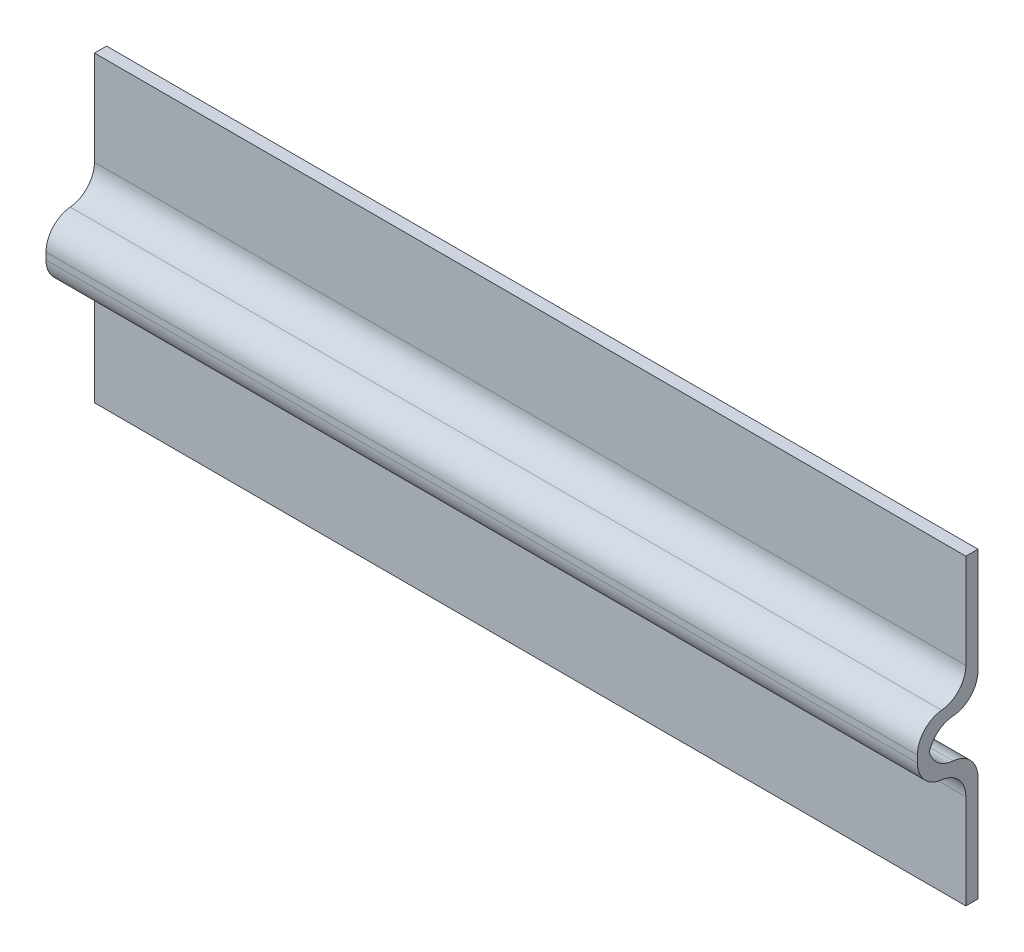
from build123d import *

# Parameters (mm, degrees)
SM_START               = -161.965
SM_BASE_FLANGE_1_DEPTH = 323.93
FILLET_3_R             = 10
FILLET_4_R             = 10
FILLET_5_R             = 10
FILLET_6_R             = 10
FILLET_7_R             = 10


# Read off the part's stored shape, not the designer's step: 基体-法兰1
with BuildPart() as part:
    # 基体-法兰1 outline → 基体-法兰1 (new body)
    with BuildSketch(Plane(origin=(0, 0, 0), x_dir=(0, 0, -1), z_dir=(1, 0, 0)).offset(SM_START)):
        Polygon((-4.503882243, 0), (0, 0), (0, 49.038822429), (-18.519411214, 49.038822429), (-18.519411214, 63.558233643), (0, 63.558233643), (0, 112.597056072), (-4.503882243, 112.597056072), (-4.503882243, 67.558233643), (-22.519411214, 67.558233643), (-22.519411214, 45.038822429), (-4.503882243, 45.038822429), align=None)
    extrude(amount=SM_BASE_FLANGE_1_DEPTH)

    # 圆角3
    fillet_3_edges = [part.edges().sort_by_distance(p)[0] for p in [
        (0, 45.038822429, 22.519411214),
        (0, 67.558233643, 22.519411214),
    ]]
    fillet(fillet_3_edges, radius=FILLET_3_R)

    # 圆角4
    # the kernel refuses this fillet: 10 mm, written as the material it adds along each edge
    with BuildSketch(Plane(origin=(-161.965, 49.038822429, 18.519411214), x_dir=(0, 1, 0), z_dir=(1, 0, 0)), Plane(origin=(-161.965, 63.558233643, 18.519411214), x_dir=(0, 0, -1), z_dir=(1, 0, 0))) as fillet_4_piece_1:
        with BuildLine():
            CenterArc((FILLET_4_R, -FILLET_4_R), FILLET_4_R, 90, 90)
            Line((0, -FILLET_4_R), (0, 0))
            Line((0, 0), (FILLET_4_R, 0))
        make_face()
    extrude(amount=323.93)

    # 圆角5
    fillet_5_edges = [part.edges().sort_by_distance(p)[0] for p in [
        (0, 63.558233643, 0),
        (0, 49.038822429, 0),
    ]]
    fillet(fillet_5_edges, radius=FILLET_5_R)

    # 圆角6
    fillet_6_edges = [part.edges().sort_by_distance(p)[0] for p in [
        (0, 45.038822429, 4.503882243),
    ]]
    fillet(fillet_6_edges, radius=FILLET_6_R)

    # 圆角7
    fillet_7_edges = [part.edges().sort_by_distance(p)[0] for p in [
        (0, 67.558233643, 4.503882243),
    ]]
    fillet(fillet_7_edges, radius=FILLET_7_R)


solid = part.part
